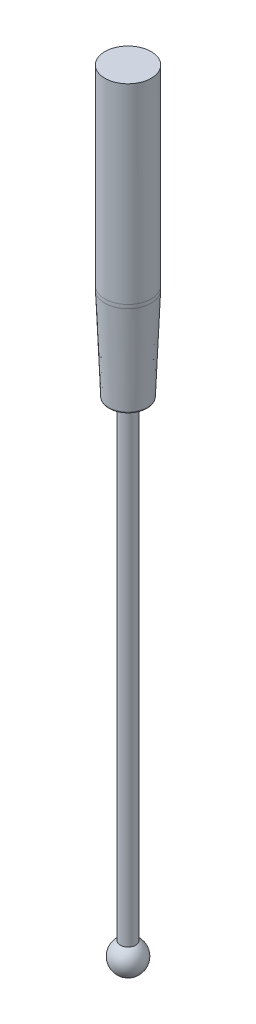
from build123d import *

# Parameters (mm, degrees)
FILLET1_R = 0.1
FILLET2_R = 6


with BuildPart() as part:
    # Sketch1 → Revolve1 (revolve)
    with BuildSketch(Plane.XY):
        with BuildLine():
            Line((0, 0), (1.5, 0))
            Line((1.5, 0), (1.5, -12.5))
            Line((1.5, -12.5), (1.25, -18.682020119))
            Line((1.25, -18.682020119), (0.5, -18.682020119))
            Line((0.5, -18.682020119), (0.5, -49.133974596))
            ThreePointArc((0.5, -49.133974596), (0.965925826, -50.258819045), (0, -51))
            Line((0, -51), (0, 0))
        make_face()
    revolve(axis=Axis((0, -1574.891797032, 0), (0, 1, 0)))

    # Fillet1
    fillet1_edges = [part.edges().sort_by_distance(p)[0] for p in [
        (-1.25, -18.682020119, 0),
    ]]
    fillet(fillet1_edges, radius=FILLET1_R)

    # Fillet2
    # the kernel refuses this fillet: 6 mm, written as the material it takes off along each edge
    with BuildSketch(Plane(origin=(0, -12.5, 0), x_dir=(1, 0, 0), z_dir=(0, 0, 1))) as fillet2_piece_1:
        with BuildLine():
            CenterArc((1.5 - FILLET2_R, FILLET2_R * 0.0202116676517), FILLET2_R, 357.684228799, 2.315771201)
            Line((1.5, FILLET2_R * 0.0202116676517), (1.5, 0))
            Line((1.5, 0), (1.5 - FILLET2_R * 0.000816689391513, -FILLET2_R * 0.0201951609972))
        make_face()
    revolve(axis=Axis((0, -12.5, 0), (0, 1, 0)), mode=Mode.SUBTRACT)


solid = part.part
